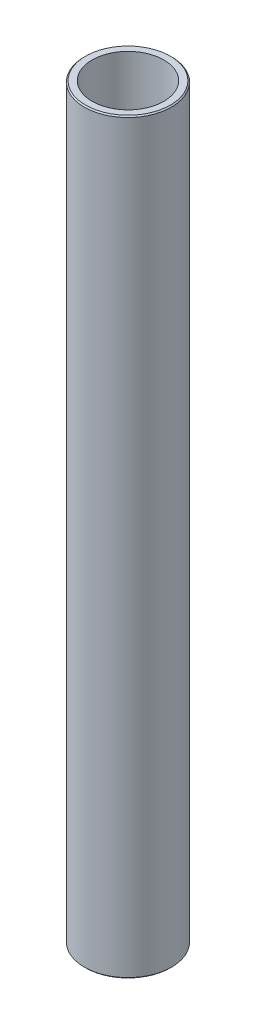
from build123d import *

# Parameters (mm, degrees)
SKETCH1_R           = 35
BOSS_EXTRUDE1_DEPTH = 600
SKETCH2_R           = 28.81091596
CUT_EXTRUDE1_DEPTH  = 603.038204768
CHAMFER1_SIZE       = 0.953607244


with BuildPart() as part:
    # Sketch1 → Boss-Extrude1 (new body)
    with BuildSketch(Plane(origin=(0, 0, 0), x_dir=(1, 0, 0), z_dir=(0, 1, 0))):
        Circle(SKETCH1_R)
    extrude(amount=BOSS_EXTRUDE1_DEPTH)

    # Sketch2 → Cut-Extrude1 (cut, through all)
    with BuildSketch(Plane(origin=(0, 0, 0), x_dir=(1, 0, 0), z_dir=(0, 1, 0))):
        Circle(SKETCH2_R)
    extrude(amount=CUT_EXTRUDE1_DEPTH, mode=Mode.SUBTRACT)

    # Chamfer1
    chamfer1_edges = [part.edges().sort_by_distance(p)[0] for p in [
        (-35, 600, 0),
        (-35, 0, 0),
    ]]
    chamfer(chamfer1_edges, length=CHAMFER1_SIZE)


solid = part.part
